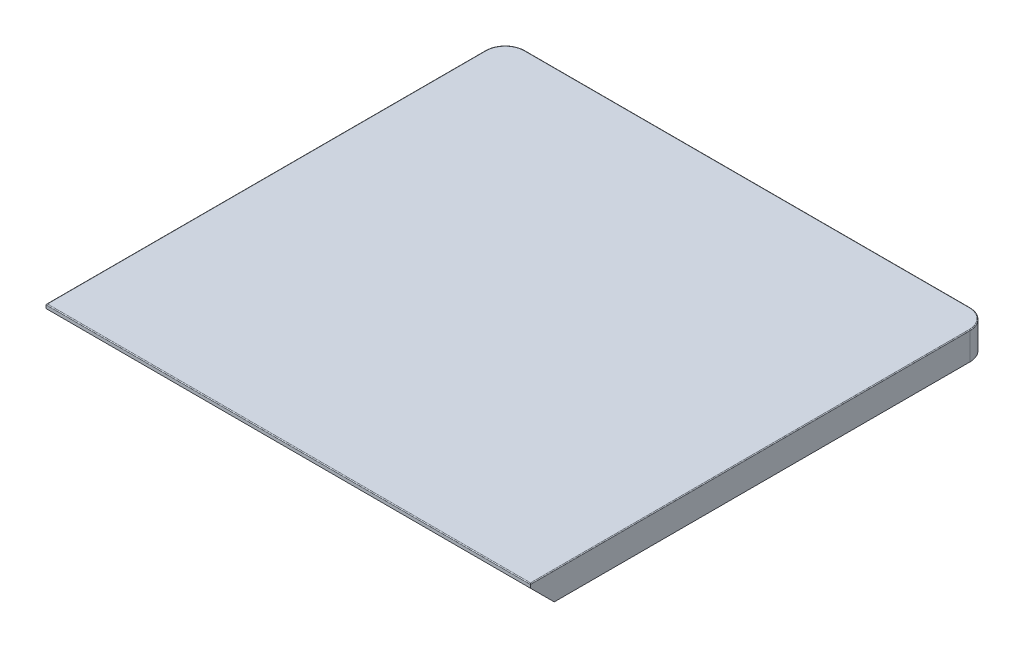
from build123d import *

# Parameters (mm, degrees)
SKETCH1_W           = 612
SKETCH1_H           = 580
BOSS_EXTRUDE1_DEPTH = 35
FILLET9_R           = 1
CHAMFER1_SIZE       = 30
FILLET10_R          = 25
SKETCH3_W           = 37.926087763
SKETCH3_H           = 455
BOSS_EXTRUDE2_DEPTH = 35
CHAMFER2_SIZE       = 50
SKETCH4_W           = 12.193127302
SKETCH4_H           = 355
CUT_EXTRUDE1_DEPTH  = 20


with BuildPart() as part:
    # Sketch1 → Boss-Extrude1 (new body)
    with BuildSketch(Plane(origin=(0, 0, 0), x_dir=(1, 0, 0), z_dir=(0, 1, 0))):
        with Locations((-191.292576419, -30)):
            Rectangle(SKETCH1_W, SKETCH1_H)
    extrude(amount=BOSS_EXTRUDE1_DEPTH)

    # Fillet9
    fillet9_edges = [part.edges().sort_by_distance(p)[0] for p in [
        (114.707423581, 35, 30),
        (-191.292576419, 35, -260),
        (-497.292576419, 35, 30),
        (-191.292576419, 35, 320),
    ]]
    fillet(fillet9_edges, radius=FILLET9_R)

    # Chamfer1
    chamfer1_edges = [part.edges().sort_by_distance(p)[0] for p in [
        (-191.292576419, 0, 320),
    ]]
    chamfer(chamfer1_edges, length=CHAMFER1_SIZE)

    # Fillet10
    # the kernel refuses this fillet: 25 mm, written as the material it takes off along each edge
    with BuildSketch(Plane(origin=(89.707423581, 35, -235), x_dir=(1, 0, 0), z_dir=(0, 0, 1))) as fillet10_piece_1:
        with BuildLine():
            CenterArc((24, -1), 1, 0, 90)
            Line((25, -1), (25, 0))
            Line((25, 0), (24, 0))
        make_face()
    revolve(axis=Axis((89.707423581, 35, -235), (0, 1, 0)), revolution_arc=90, mode=Mode.SUBTRACT)
    with BuildSketch(Plane(origin=(-472.292576419, 35, -235), x_dir=(0, 0, -1), z_dir=(1, 0, 0))) as fillet10_piece_2:
        with BuildLine():
            CenterArc((24, -1), 1, 0, 90)
            Line((25, -1), (25, 0))
            Line((25, 0), (24, 0))
        make_face()
    revolve(axis=Axis((-472.292576419, 35, -235), (0, 1, 0)), revolution_arc=90, mode=Mode.SUBTRACT)
    with BuildSketch(Plane(origin=(-497.292576419, -62.5, -260), x_dir=(0, 0, 1), z_dir=(0, 1, 0))) as fillet10_piece_3:
        with BuildLine():
            CenterArc((FILLET10_R, FILLET10_R), FILLET10_R, 180, 90)
            Line((0, FILLET10_R), (0, 0))
            Line((0, 0), (FILLET10_R, 0))
        make_face()
    extrude(amount=97.5, mode=Mode.SUBTRACT)
    with BuildSketch(Plane(origin=(114.707423581, -62.5, -260), x_dir=(0, 0, 1), z_dir=(0, 1, 0))) as fillet10_piece_4:
        with BuildLine():
            CenterArc((FILLET10_R, -FILLET10_R), FILLET10_R, 90, 90)
            Line((0, -FILLET10_R), (0, 0))
            Line((0, 0), (FILLET10_R, 0))
        make_face()
    extrude(amount=97.5, mode=Mode.SUBTRACT)

    # Sketch3 → Boss-Extrude2 (add)
    with BuildSketch(Plane.XZ):
        with Locations((0.812875154, 2.003525588)):
            Rectangle(SKETCH3_W, SKETCH3_H)
        Polygon((-362.292576419, -224.84785724), (-402.292576419, -225.603407802), (-402.292576419, 229.396592198), (-362.292576419, 229.396592198), align=None)
    extrude(amount=BOSS_EXTRUDE2_DEPTH)

    # Chamfer2
    # the kernel refuses this chamfer: 50 mm, written as the material it takes off along each edge
    with BuildSketch(Plane(origin=(148.360068433, -35, -225.496474412), x_dir=(0, 0.9996219169112966, -0.027495876610586594), z_dir=(-1, 0, 0))) as chamfer2_piece_1_section:
        Polygon((CHAMFER2_SIZE * 0.999621916911, -CHAMFER2_SIZE * 0.0274958766106), (-CHAMFER2_SIZE * 0.0274958766106, -CHAMFER2_SIZE * 0.999621916911), (0, 0), align=None)
    chamfer2_piece_1 = extrude(amount=295.09438656, mode=Mode.PRIVATE)
    chamfer2_piece_1 = split(chamfer2_piece_1, bisect_by=Plane(origin=(0.812875153, 0, -207.548086942), z_dir=(0, -1, 0)), keep=Keep.TOP, mode=Mode.PRIVATE)
    add(chamfer2_piece_1, mode=Mode.SUBTRACT)
    with BuildSketch(Plane(origin=(-233.731359359, -35, -222.419494743), x_dir=(0.0005192705001048889, 0.9996219169112966, -0.027490972858964104), z_dir=(-0.999821655017895, 0, -0.018885395343422682))) as chamfer2_piece_2_section:
        Polygon((CHAMFER2_SIZE * 0.999621916911, -CHAMFER2_SIZE * 0.0274958766106), (-CHAMFER2_SIZE * 0.0274958766106, -CHAMFER2_SIZE * 0.999621916911), (0, 0), align=None)
    chamfer2_piece_2 = extrude(amount=297.175433868, mode=Mode.PRIVATE)
    chamfer2_piece_2 = split(chamfer2_piece_2, bisect_by=Plane(origin=(-382.631538812, 0, -207.280446055), z_dir=(0, -1, 0)), keep=Keep.TOP, mode=Mode.PRIVATE)
    add(chamfer2_piece_2, mode=Mode.SUBTRACT)
    with BuildSketch(Plane(origin=(-530.876725818, -35, 229.396592198), x_dir=(0, 0.9996219169112966, 0.027495876610586594), z_dir=(1, 0, 0))) as chamfer2_piece_3_section:
        Polygon((CHAMFER2_SIZE * 0.999621916911, -CHAMFER2_SIZE * 0.0274958766106), (-CHAMFER2_SIZE * 0.0274958766106, -CHAMFER2_SIZE * 0.999621916911), (0, 0), align=None)
    chamfer2_piece_3 = extrude(amount=297.168298797, mode=Mode.PRIVATE)
    chamfer2_piece_3 = split(chamfer2_piece_3, bisect_by=Plane(origin=(-382.292576419, 0, 211.448204728), z_dir=(0, -1, 0)), keep=Keep.TOP, mode=Mode.PRIVATE)
    add(chamfer2_piece_3, mode=Mode.SUBTRACT)
    with BuildSketch(Plane(origin=(-146.734318126, -35, 229.503525588), x_dir=(0, 0.9996219169112966, 0.027495876610586594), z_dir=(1, 0, 0))) as chamfer2_piece_4_section:
        Polygon((CHAMFER2_SIZE * 0.999621916911, -CHAMFER2_SIZE * 0.0274958766106), (-CHAMFER2_SIZE * 0.0274958766106, -CHAMFER2_SIZE * 0.999621916911), (0, 0), align=None)
    chamfer2_piece_4 = extrude(amount=295.09438656, mode=Mode.PRIVATE)
    chamfer2_piece_4 = split(chamfer2_piece_4, bisect_by=Plane(origin=(0.812875153, 0, 211.555138118), z_dir=(0, -1, 0)), keep=Keep.TOP, mode=Mode.PRIVATE)
    add(chamfer2_piece_4, mode=Mode.SUBTRACT)

    # Sketch4 → Cut-Extrude1 (cut)
    with BuildSketch(Plane.XZ.offset(35)):
        with Locations((-0.673352928, 2.003525588)):
            Rectangle(SKETCH4_W, SKETCH4_H)
        Polygon((-390.446989022, 179.396592198), (-390.446989022, -175.370740457), (-375.815236259, -175.094364731), (-375.815236259, 179.396592198), align=None)
    extrude(amount=-CUT_EXTRUDE1_DEPTH, mode=Mode.SUBTRACT)


solid = part.part
